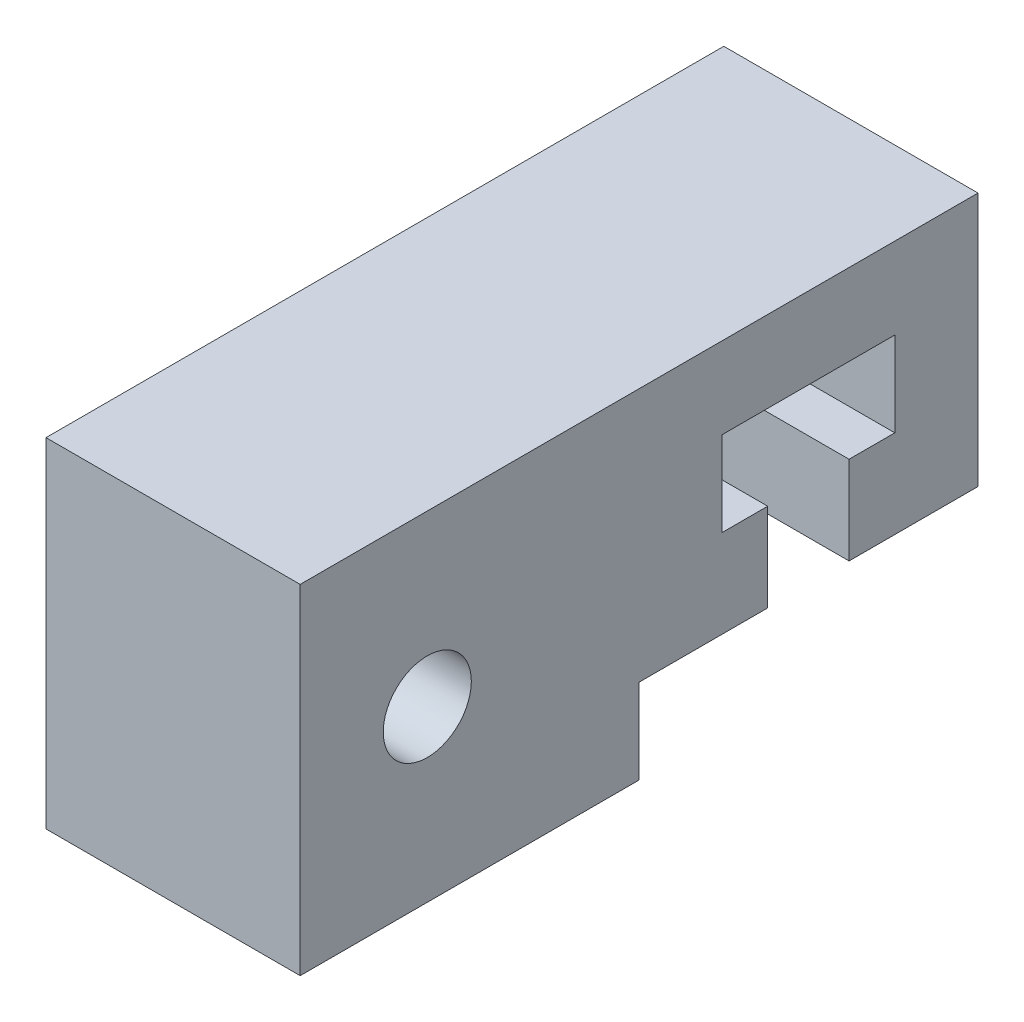
from build123d import *

# Parameters (mm, degrees)
BOSS_EXTRUDE1_DEPTH      = 4.7625
BOSS_EXTRUDE1_DEPTH_BACK = 4.7625
SKETCH2_R                = 1.651


with BuildPart() as part:
    # Sketch2 → Boss-Extrude1 (new, two sides: drawn at the far end of the back side and taken through both)
    with BuildSketch(Plane(origin=(0, 0, 0), x_dir=(0, 0, -1), z_dir=(1, 0, 0)).offset(-BOSS_EXTRUDE1_DEPTH_BACK)):
        Polygon((-4.7625, 6.35), (-4.7625, -6.35), (7.9375, -6.35), (7.9375, -3.175), (12.75774613, -3.175), (12.75774613, 0.127), (11.04324613, 0.127), (11.04324613, 3.302), (17.52024613, 3.302), (17.52024613, 0.127), (15.80574613, 0.127), (15.80574613, -3.175), (20.6375, -3.175), (20.6375, 6.35), align=None)
        Circle(SKETCH2_R, mode=Mode.SUBTRACT)
    extrude(amount=BOSS_EXTRUDE1_DEPTH + BOSS_EXTRUDE1_DEPTH_BACK)


solid = part.part
